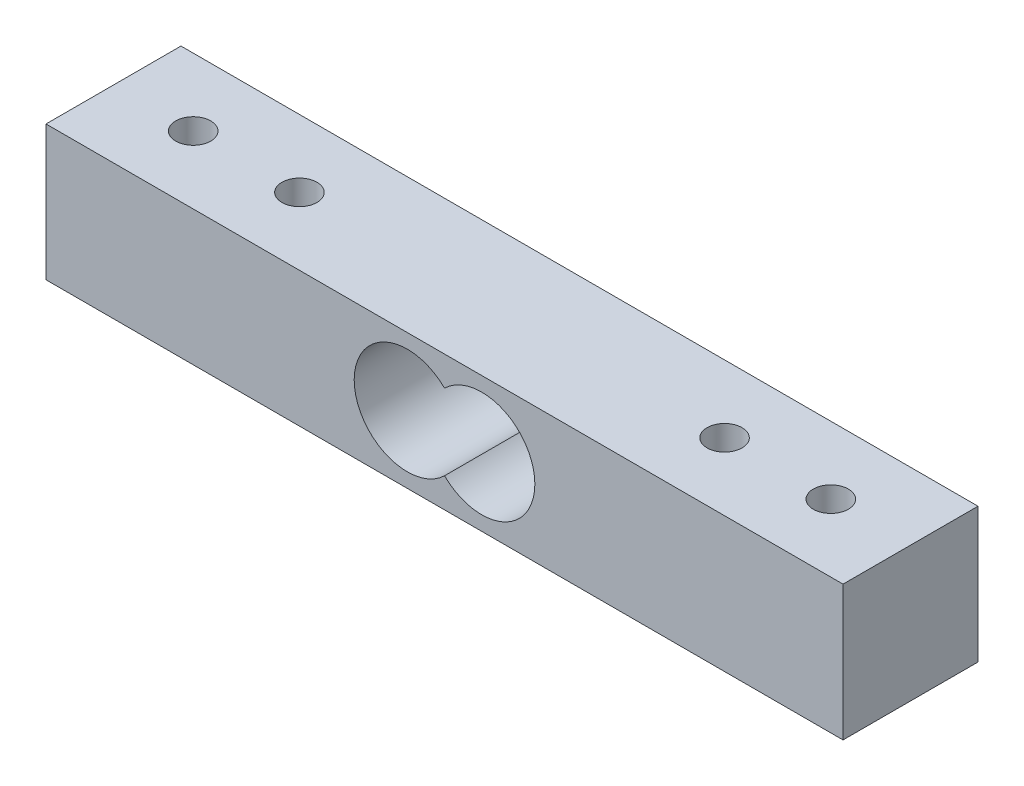
from build123d import *

# Parameters (mm, degrees)
AUFSATZ_LINEAR_AUSTRAGEN1_DEPTH      = 6.35
AUFSATZ_LINEAR_AUSTRAGEN1_DEPTH_BACK = 6.35
SKIZZE2_W                            = 75
SKIZZE2_H                            = 12.7
SKIZZE2_R                            = 1.65
SCHNITT_LINEAR_AUSTRAGEN2_DEPTH      = 39.560277489
SCHNITT_LINEAR_AUSTRAGEN2_DEPTH_BACK = 39.560277489


with BuildPart() as part:
    # Skizze2 → Aufsatz-Linear austragen1 (new, two sides: drawn at the far end of the back side and taken through both)
    with BuildSketch(Plane(origin=(0, 0, 0), x_dir=(1, 0, 0), z_dir=(0, 1, 0)).offset(-AUFSATZ_LINEAR_AUSTRAGEN1_DEPTH_BACK)):
        Rectangle(SKIZZE2_W, SKIZZE2_H)
        with Locations((-20, 0)):
            Circle(SKIZZE2_R, mode=Mode.SUBTRACT)
        with Locations((-30, 0)):
            Circle(SKIZZE2_R, mode=Mode.SUBTRACT)
        with Locations((20, 0)):
            Circle(SKIZZE2_R, mode=Mode.SUBTRACT)
        with Locations((30, 0)):
            Circle(SKIZZE2_R, mode=Mode.SUBTRACT)
    extrude(amount=AUFSATZ_LINEAR_AUSTRAGEN1_DEPTH + AUFSATZ_LINEAR_AUSTRAGEN1_DEPTH_BACK)

    # Skizze3 → Schnitt-Linear austragen2 (cut, two sides: drawn at the far end of the back side and taken through both)
    with BuildSketch(Plane.XY.offset(-SCHNITT_LINEAR_AUSTRAGEN2_DEPTH_BACK)):
        with BuildLine():
            ThreePointArc((0, 3.570714214), (-8.5, 0), (0, -3.570714214))
            ThreePointArc((0, -3.570714214), (8.5, 0), (0, 3.570714214))
        make_face()
    extrude(amount=SCHNITT_LINEAR_AUSTRAGEN2_DEPTH + SCHNITT_LINEAR_AUSTRAGEN2_DEPTH_BACK, mode=Mode.SUBTRACT)


solid = part.part
